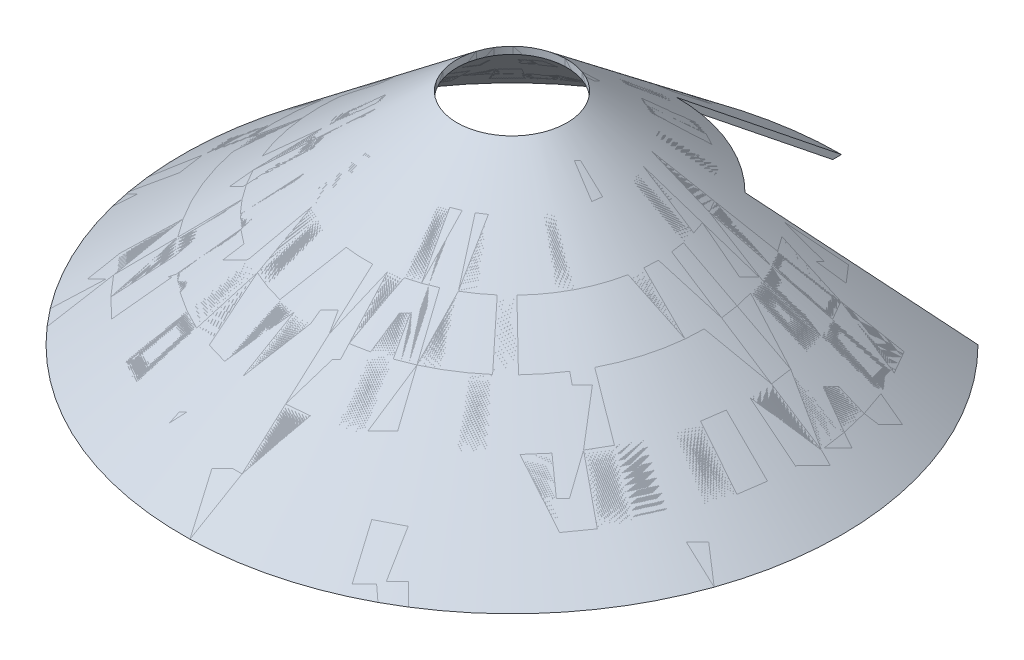
from build123d import *

# Parameters (mm, degrees)
CUT_EXTRUDE1_DEPTH = 76.2


# Read off the part's stored shape, not the designer's step: Revolve2
with BuildPart() as part:
    # Revolve2 outline → Revolve2 (revolve)
    with BuildSketch(Plane.XY):
        Polygon((12.7, 49.173606444), (74.167008055, 0), (76.2, 0), (12.7, 50.8), align=None)
    revolve(axis=Axis((0, 0, 0), (0, 1, 0)))


with BuildPart() as body_2:
    # Revolve2 2 outline → Revolve2 2 (revolve)
    with BuildSketch(Plane.XY):
        Polygon((12.7, 50.8), (12.7, 49.173606444), (74.167008055, 0), (76.2, 0), align=None)
    revolve(axis=Axis((0, 0, 0), (0, 1, 0)))


with BuildPart() as cut_extrude1_tool:
    # Sketch2 → Cut-Extrude1 (new, symmetric)
    with BuildSketch(Plane(origin=(0, 0, 0), x_dir=(1, 0, 0), z_dir=(0, 1, 0))):
        with BuildLine():
            Line((0, 38.1), (0, 76.2))
            ThreePointArc((0, 76.2), (29.160477546, 70.399620377), (53.881536726, 53.881536726))
            Line((53.881536726, 53.881536726), (26.940768363, 26.940768363))
            ThreePointArc((26.940768363, 26.940768363), (14.580238773, 35.199810189), (0, 38.1))
        make_face()
    extrude(amount=CUT_EXTRUDE1_DEPTH, both=True)


with BuildPart() as part_1:
    add(part.part)

    # Cut-Extrude1: cut by cut_extrude1_tool
    add(cut_extrude1_tool.part, mode=Mode.SUBTRACT)


with BuildPart() as body_2_1:
    add(body_2.part)

    # Cut-Extrude1: cut by cut_extrude1_tool
    add(cut_extrude1_tool.part, mode=Mode.SUBTRACT)


solid = Compound([part_1.part, body_2_1.part])
